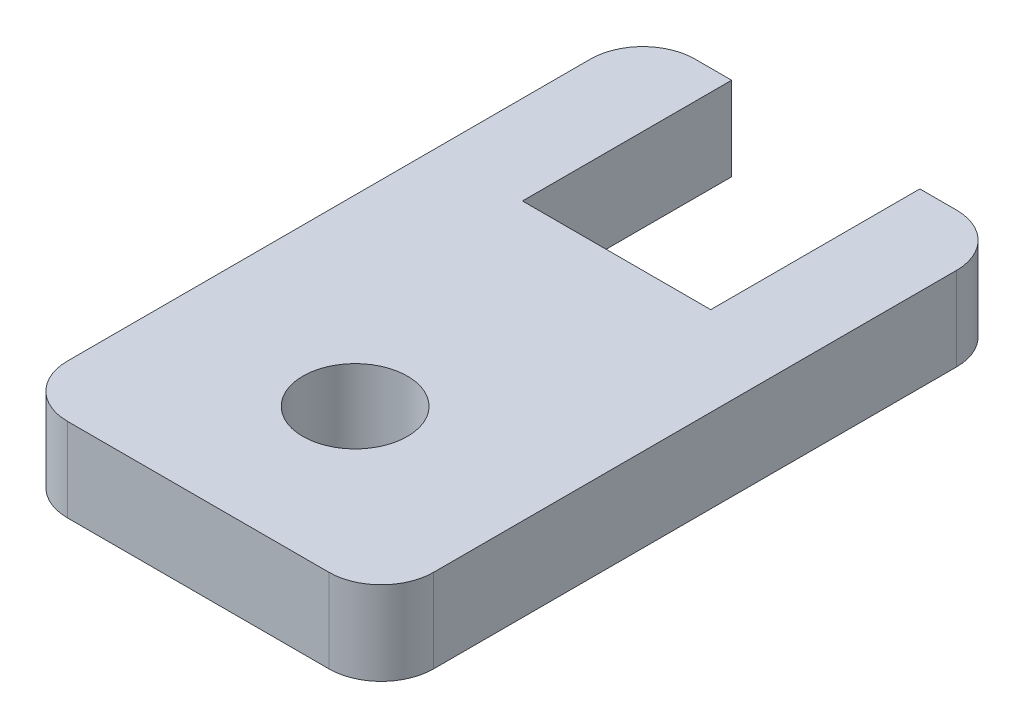
from build123d import *

# Parameters (mm, degrees)
SKETCH1_W           = 7
SKETCH1_H           = 12
BOSS_EXTRUDE1_DEPTH = 1.6
SKETCH3_W           = 3.6
SKETCH3_H           = 4
CUT_EXTRUDE2_DEPTH  = 8.128113355
SKETCH4_R           = 1
CUT_EXTRUDE3_DEPTH  = 10
FILLET1_R           = 1


with BuildPart() as part:
    # Sketch1 → Boss-Extrude1 (new body)
    with BuildSketch(Plane(origin=(0, 0, 0), x_dir=(1, 0, 0), z_dir=(0, 1, 0))):
        Rectangle(SKETCH1_W, SKETCH1_H)
    extrude(amount=BOSS_EXTRUDE1_DEPTH)

    # Sketch3 → Cut-Extrude2 (cut, through all)
    with BuildSketch(Plane.XZ):
        with Locations((0, -4)):
            Rectangle(SKETCH3_W, SKETCH3_H)
    extrude(amount=-CUT_EXTRUDE2_DEPTH, mode=Mode.SUBTRACT)

    # Sketch4 → Cut-Extrude3 (cut)
    with BuildSketch(Plane(origin=(0, 1.6, 0), x_dir=(1, 0, 0), z_dir=(0, 1, 0))):
        with Locations((0, -3)):
            Circle(SKETCH4_R)
    extrude(amount=-CUT_EXTRUDE3_DEPTH, mode=Mode.SUBTRACT)

    # Fillet1
    fillet1_edges = [part.edges().sort_by_distance(p)[0] for p in [
        (3.5, 0.8, -6),
        (-3.5, 0.8, -6),
        (-3.5, 0.8, 6),
        (3.5, 0.8, 6),
    ]]
    fillet(fillet1_edges, radius=FILLET1_R)


solid = part.part
